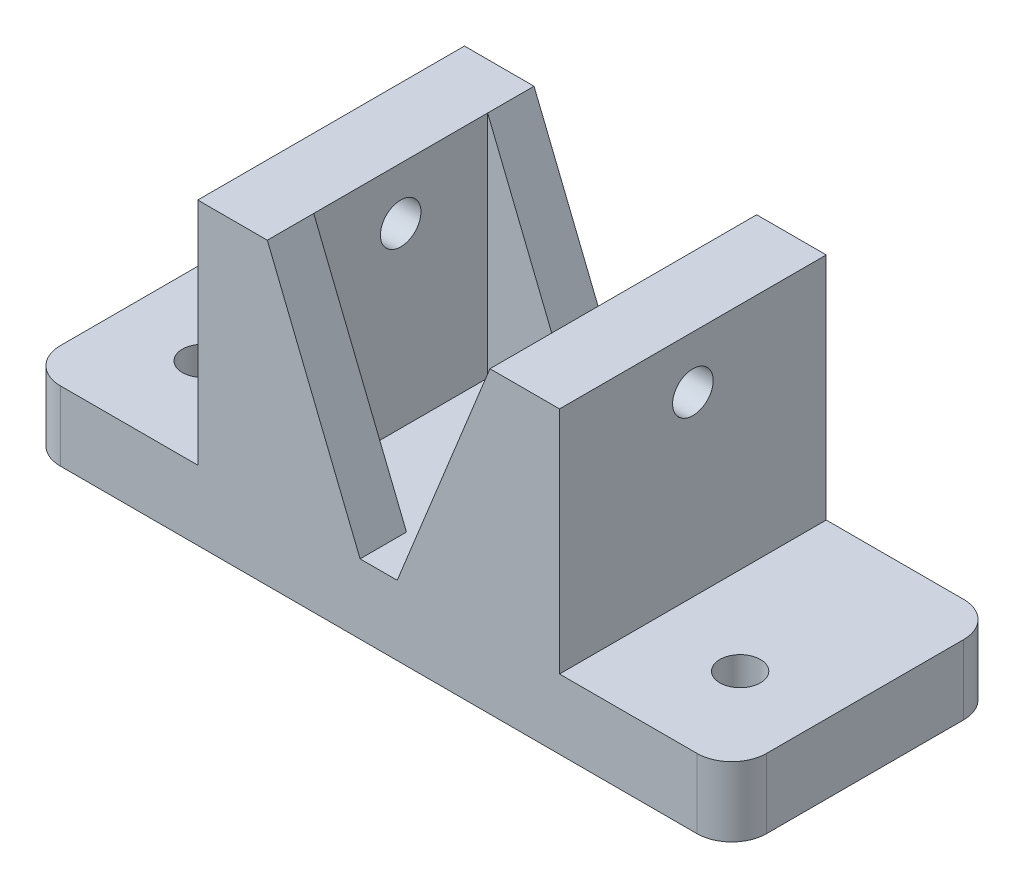
from build123d import *

# Parameters (mm, degrees)
SKETCH1_R           = 1.75
BOSS_EXTRUDE1_DEPTH = 6
SKETCH2_W           = 6
SKETCH2_H           = 23
BOSS_EXTRUDE2_DEPTH = 19.8
SKETCH3_R           = 1.75
CUT_EXTRUDE1_DEPTH  = 40.8
SKETCH4_W           = 8
SKETCH4_H           = 4
BOSS_EXTRUDE3_DEPTH = 19.8
CUT_EXTRUDE3_DEPTH  = 93.8


with BuildPart() as part:
    # Sketch1 → Boss-Extrude1 (new body)
    with BuildSketch(Plane(origin=(0, 0, 0), x_dir=(1, 0, 0), z_dir=(0, 1, 0))):
        with BuildLine():
            Line((-27.452011702, -8), (27.452011702, -8))
            ThreePointArc((27.452011702, -8), (29.573332045, -7.121320344), (30.452011702, -5))
            Line((30.452011702, -5), (30.452011702, 12))
            ThreePointArc((30.452011702, 12), (29.573332045, 14.121320344), (27.452011702, 15))
            Line((27.452011702, 15), (-27.452011702, 15))
            ThreePointArc((-27.452011702, 15), (-29.573332045, 14.121320344), (-30.452011702, 12))
            Line((-30.452011702, 12), (-30.452011702, -5))
            ThreePointArc((-30.452011702, -5), (-29.573332045, -7.121320344), (-27.452011702, -8))
        make_face()
        with Locations((-23.175, 0)):
            Circle(SKETCH1_R, mode=Mode.SUBTRACT)
        with Locations((23.175, 0)):
            Circle(SKETCH1_R, mode=Mode.SUBTRACT)
    extrude(amount=BOSS_EXTRUDE1_DEPTH)

    # Sketch2 → Boss-Extrude2 (add)
    with BuildSketch(Plane(origin=(0, 6, 0), x_dir=(1, 0, 0), z_dir=(0, 1, 0))):
        with Locations((12.6, 3.5)):
            Rectangle(SKETCH2_W, SKETCH2_H)
        with Locations((-12.6, 3.5)):
            Rectangle(SKETCH2_W, SKETCH2_H)
    extrude(amount=BOSS_EXTRUDE2_DEPTH)

    # Sketch3 → Cut-Extrude1 (cut)
    with BuildSketch(Plane.ZY.offset(15.6)):
        with Locations((-3.5, 21.3)):
            Circle(SKETCH3_R)
    extrude(amount=-CUT_EXTRUDE1_DEPTH, mode=Mode.SUBTRACT)

    # Sketch4 → Boss-Extrude3 (add)
    with BuildSketch(Plane(origin=(0, 6, 0), x_dir=(1, 0, 0), z_dir=(0, 1, 0))):
        with Locations((5.6, 13)):
            Rectangle(SKETCH4_W, SKETCH4_H)
        with Locations((-5.6, 13)):
            Rectangle(SKETCH4_W, SKETCH4_H)
        with Locations((-5.6, -6)):
            Rectangle(SKETCH4_W, SKETCH4_H)
        with Locations((5.6, -6)):
            Rectangle(SKETCH4_W, SKETCH4_H)
    extrude(amount=BOSS_EXTRUDE3_DEPTH)

    # Sketch5 → Cut-Extrude3 (cut)
    with BuildSketch(Plane(origin=(0, 0, -15), x_dir=(-1, 0, 0), z_dir=(0, 0, -1))):
        Polygon((-1.6, 6), (-9.6, 25.8), (-1.6, 25.8), align=None)
        Polygon((1.6, 6), (9.6, 25.8), (1.6, 25.8), align=None)
    extrude(amount=-CUT_EXTRUDE3_DEPTH, mode=Mode.SUBTRACT)


solid = part.part
